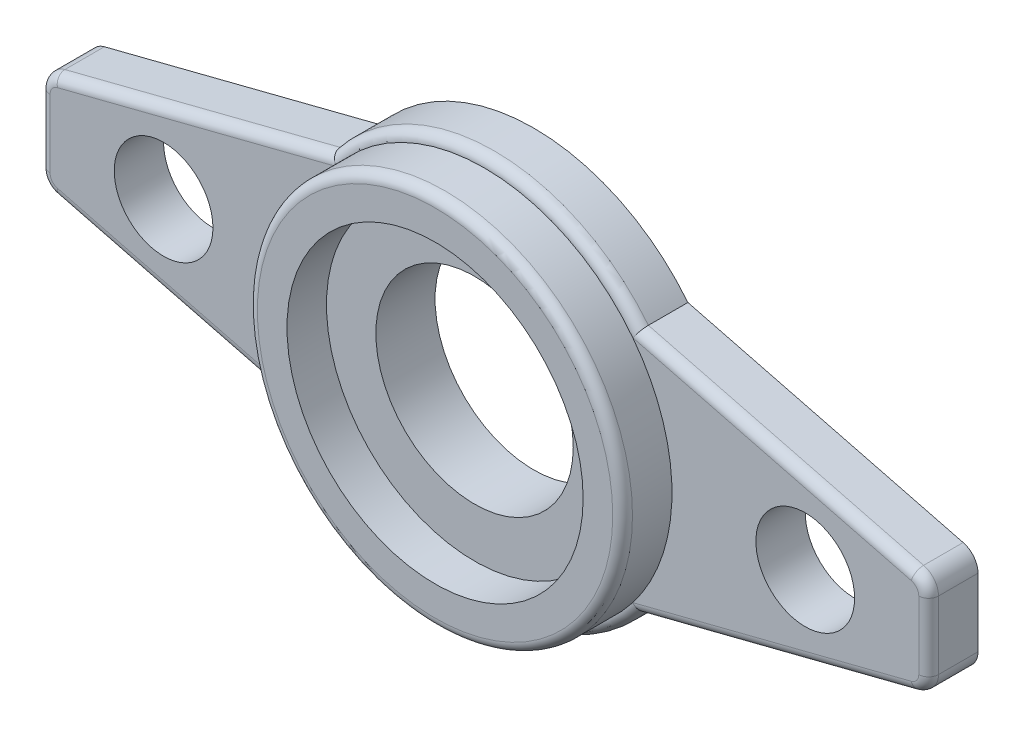
from build123d import *

# Parameters (mm, degrees)
SKETCH2_R           = 5
SKETCH2_R_2         = 20
SKETCH2_R_3         = 19
BOSS_EXTRUDE1_DEPTH = 5
SKETCH2_3_R         = 19
SKETCH2_3_R_2       = 15
BOSS_EXTRUDE2_DEPTH = 10
SKETCH2_4_R         = 15
SKETCH2_4_R_2       = 10
BOSS_EXTRUDE3_DEPTH = 6
FILLET1_R           = 1
FILLET2_R           = 1


with BuildPart() as part:
    # Sketch2 → Boss-Extrude1 (new body)
    # profile 1 of 3: a face of its own
    with BuildSketch(Plane.XY):
        with BuildLine():
            ThreePointArc((-15.612494996, -12.5), (-20, 0), (-15.612494996, 12.5))
            Line((-15.612494996, 12.5), (-43.494568834, 5.384201849))
            ThreePointArc((-43.494568834, 5.384201849), (-44.579420411, 4.673276105), (-45, 3.446315972))
            Line((-45, 3.446315972), (-45, -3.446315972))
            ThreePointArc((-45, -3.446315972), (-44.579420411, -4.673276105), (-43.494568834, -5.384201849))
            Line((-43.494568834, -5.384201849), (-15.612494996, -12.5))
        make_face()
        with Locations((-32.5, 0)):
            Circle(SKETCH2_R, mode=Mode.SUBTRACT)
    # profile 2 of 3: a face of its own
    with BuildSketch(Plane.XY):
        Circle(SKETCH2_R_2)
        Circle(SKETCH2_R_3, mode=Mode.SUBTRACT)
    # profile 3 of 3: a face of its own
    with BuildSketch(Plane.XY):
        with BuildLine():
            Line((45, -3.446315972), (45, 3.446315972))
            ThreePointArc((45, 3.446315972), (44.579420411, 4.673276105), (43.494568834, 5.384201849))
            Line((43.494568834, 5.384201849), (15.612494996, 12.5))
            ThreePointArc((15.612494996, 12.5), (18.871273141, 6.623824427), (20, 0))
            ThreePointArc((20, 0), (18.871273141, -6.623824427), (15.612494996, -12.5))
            Line((15.612494996, -12.5), (43.494568834, -5.384201849))
            ThreePointArc((43.494568834, -5.384201849), (44.579420411, -4.673276105), (45, -3.446315972))
        make_face()
        with Locations((32.5, 0)):
            Circle(SKETCH2_R, mode=Mode.SUBTRACT)
    extrude(amount=BOSS_EXTRUDE1_DEPTH)

    # Sketch2<3> → Boss-Extrude2 (add)
    with BuildSketch(Plane.XY):
        Circle(SKETCH2_3_R)
        Circle(SKETCH2_3_R_2, mode=Mode.SUBTRACT)
    extrude(amount=BOSS_EXTRUDE2_DEPTH)

    # Sketch2<4> → Boss-Extrude3 (add)
    with BuildSketch(Plane.XY):
        Circle(SKETCH2_4_R)
        Circle(SKETCH2_4_R_2, mode=Mode.SUBTRACT)
    extrude(amount=BOSS_EXTRUDE3_DEPTH)

    # Fillet1
    fillet1_edges = [part.edges().sort_by_distance(p)[0] for p in [
        (-19, 0, 10),
    ]]
    fillet(fillet1_edges, radius=FILLET1_R)

    # Fillet2
    fillet2_edges = [part.edges().sort_by_distance(p)[0] for p in [
        (-44.579420411, -4.673276105, 5),
        (29.553531915, 8.942100924, 5),
        (0, 20, 5),
        (-29.553531915, 8.942100924, 5),
        (-44.579420411, 4.673276105, 5),
        (-29.553531915, -8.942100924, 5),
        (0, -20, 5),
        (29.553531915, -8.942100924, 5),
        (-45, 0, 5),
        (44.579420411, -4.673276105, 5),
        (45, 0, 5),
        (44.579420411, 4.673276105, 5),
    ]]
    fillet(fillet2_edges, radius=FILLET2_R - 0.0001)  # a hair under: the kernel refuses the full size


solid = part.part
